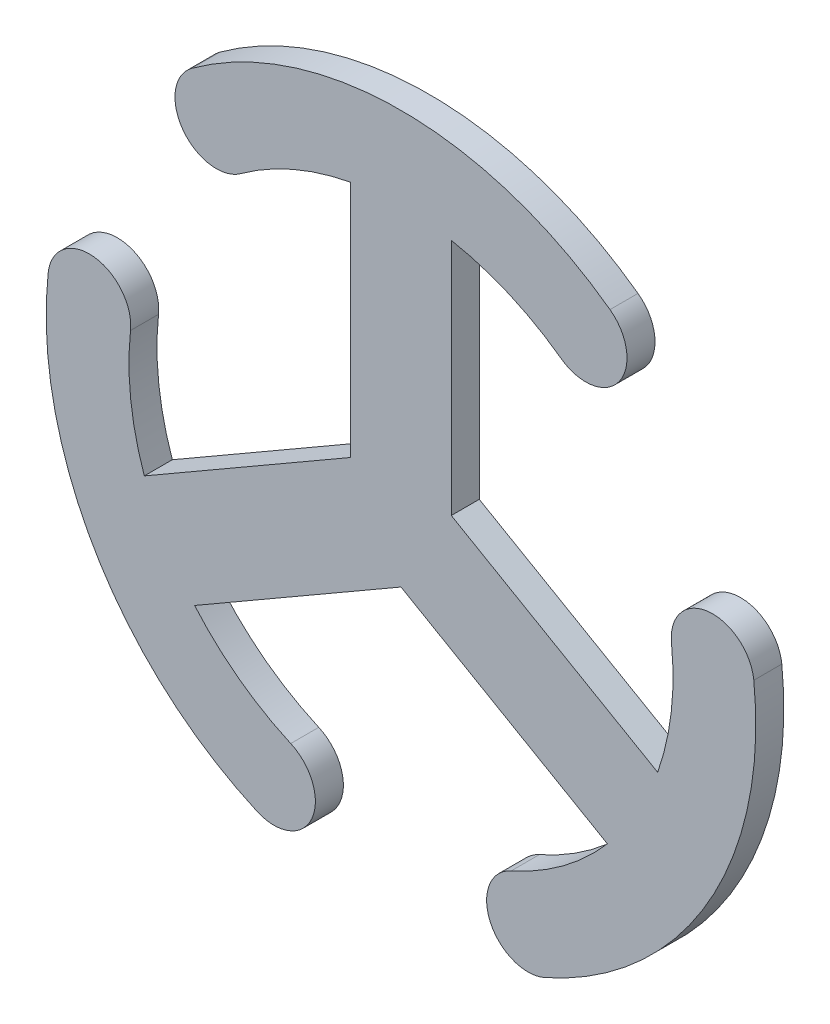
from build123d import *

# Parameters (mm, degrees)
BOSS_EXTRUDE3_DEPTH = 1.5
CIRPATTERN1_COUNT   = 3


with BuildPart() as part:
    # Sketch2 → Boss-Extrude3 (new body)
    with BuildSketch(Plane.XY):
        with BuildLine():
            ThreePointArc((-11.191746167, 15.353983774), (-11.677300028, 12.257240413), (-8.580556666, 11.771686551))
            ThreePointArc((-8.580556666, 11.771686551), (-5.778042889, 13.37208949), (-2.691924581, 14.31614819))
            Line((-2.691924581, 14.31614819), (-2.691924581, 0))
            Line((-2.691924581, 0), (2.691924581, 0))
            Line((2.691924581, 0), (2.691924581, 14.31614819))
            ThreePointArc((2.691924581, 14.31614819), (5.778042889, 13.37208949), (8.580556666, 11.771686551))
            ThreePointArc((8.580556666, 11.771686551), (11.677300028, 12.257240413), (11.191746167, 15.353983774))
            ThreePointArc((11.191746167, 15.353983774), (0, 19), (-11.191746167, 15.353983774))
        make_face()
    extrude(amount=BOSS_EXTRUDE3_DEPTH)

    # CirPattern1: part ×3 about axis
    cirpattern1_axis = Axis((0, 0, 0), (0, 0, -1))


with BuildPart() as part_1:
    add(part.part)
    for i in range(1, CIRPATTERN1_COUNT):
        add(part.part.rotate(cirpattern1_axis, i * 360 / CIRPATTERN1_COUNT))


solid = part_1.part
